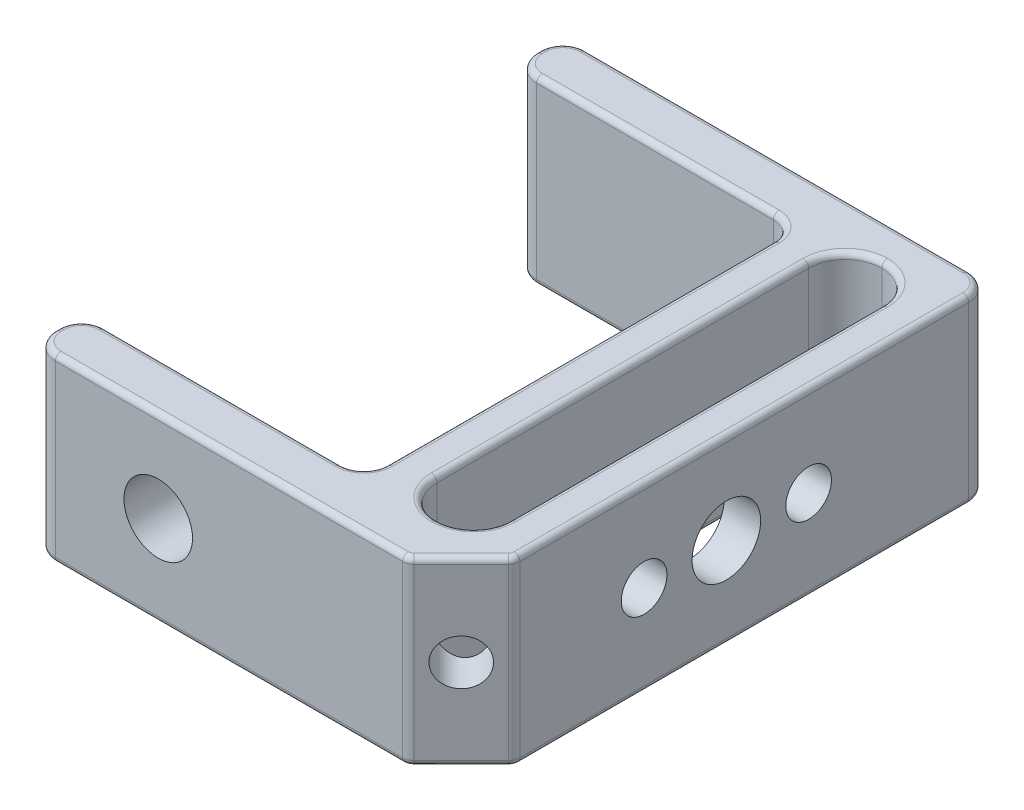
from build123d import *

# Parameters (mm, degrees)
SKETCH1_W               = 10.16
SKETCH1_H               = 61.7855
BOSS_EXTRUDE1_DEPTH     = 25.1841
FILLET2_R               = 5.08
CUT_EXTRUDE1_REACH      = 100.019
SKETCH2_R               = 4.7625
CUT_EXTRUDE2_REACH      = 94.403
CUT_EXTRUDE2_END_RADIUS = 5.08
SKETCH3_R               = 3.175
CUT_EXTRUDE3_REACH      = 100.019
CUT_EXTRUDE4_REACH      = 100.019
CUT_EXTRUDE4_END_RADIUS = 5.08
SKETCH6_R               = 3.175
FILLET3_R               = 3.175
FILLET4_R               = 1.5875
FILLET5_R               = 0.79375


with BuildPart() as part:
    # Sketch1 → Boss-Extrude1 (new body)
    with BuildSketch(Plane(origin=(0, 0, 0), x_dir=(1, 0, 0), z_dir=(0, 1, 0))):
        Polygon((0, 0), (0, -6.7945), (39.243, -6.7945), (39.243, -66.8655), (0, -66.8655), (0, -73.66), (52.07, -73.66), (59.563, -66.167), (59.563, 0), align=None)
        with Locations((49.403, -35.97275)):
            Rectangle(SKETCH1_W, SKETCH1_H, mode=Mode.SUBTRACT)
    extrude(amount=BOSS_EXTRUDE1_DEPTH)

    # Fillet2
    fillet2_edges = [part.edges().sort_by_distance(p)[0] for p in [
        (44.323, 12.59205, 5.08),
        (54.483, 12.59205, 5.08),
        (44.323, 12.59205, 66.8655),
        (54.483, 12.59205, 66.8655),
    ]]
    fillet(fillet2_edges, radius=FILLET2_R - 0.0001)  # a hair under: the kernel refuses the full size

    # Sketch2 → Cut-Extrude1 (cut, up to next)
    with BuildSketch(Plane.XY.offset(73.66), mode=Mode.PRIVATE) as cut_extrude1_sk1:
        with Locations((17.4625, 12.59205)):
            Circle(SKETCH2_R)
    cut_extrude1_tool1 = extrude(cut_extrude1_sk1.sketch, amount=-CUT_EXTRUDE1_REACH, mode=Mode.PRIVATE) & part.part
    add(cut_extrude1_tool1.solids().sort_by_distance((17.4625, 12.59205, 73.66))[0], mode=Mode.SUBTRACT)

    # Cut-Extrude2: up to this cylinder (the profile starts outside it)
    cut_extrude2_end = Plane(origin=(49.403, 12.59205, 61.7855), z_dir=(0, 1, 0)) * Cylinder(CUT_EXTRUDE2_END_RADIUS, 199.966, mode=Mode.PRIVATE)
    # Sketch3 → Cut-Extrude2 (cut, up to the surface)
    with BuildSketch(Plane(origin=(62.865, 0, 62.865), x_dir=(0.707106781186546, 0, -0.707106781186549), z_dir=(0.707106781186549, 0, 0.707106781186546)), mode=Mode.PRIVATE) as cut_extrude2_sk1:
        with Locations((-9.968084294, 12.59205)):
            Circle(SKETCH3_R)
    cut_extrude2_tool1 = extrude(cut_extrude2_sk1.sketch, amount=-CUT_EXTRUDE2_REACH, mode=Mode.PRIVATE) - cut_extrude2_end
    add(cut_extrude2_tool1.solids().sort_by_distance((55.8165, 12.59205, 69.9135))[0], mode=Mode.SUBTRACT)

    # Sketch4 → Cut-Extrude3 (cut, up to next)
    with BuildSketch(Plane(origin=(59.563, 0, 0), x_dir=(0, 0, -1), z_dir=(1, 0, 0)), mode=Mode.PRIVATE) as cut_extrude3_sk1:
        with BuildLine():
            ThreePointArc((-41.5925, 12.59205), (-36.83, 7.82955), (-32.0675, 12.59205))
            Line((-32.0675, 12.59205), (-41.5925, 12.59205))
        make_face()
    cut_extrude3_tool1 = extrude(cut_extrude3_sk1.sketch, amount=-CUT_EXTRUDE3_REACH, mode=Mode.PRIVATE) & part.part
    # Sketch4 → Cut-Extrude3 (cut, up to next)
    with BuildSketch(Plane(origin=(59.563, 0, 0), x_dir=(0, 0, -1), z_dir=(1, 0, 0)), mode=Mode.PRIVATE) as cut_extrude3_sk2:
        with BuildLine():
            Line((-41.5925, 12.59205), (-32.0675, 12.59205))
            ThreePointArc((-32.0675, 12.59205), (-36.83, 17.35455), (-41.5925, 12.59205))
        make_face()
    cut_extrude3_tool2 = extrude(cut_extrude3_sk2.sketch, amount=-CUT_EXTRUDE3_REACH, mode=Mode.PRIVATE) & part.part
    # Sketch4 → Cut-Extrude3 (cut, up to next)
    with BuildSketch(Plane(origin=(59.563, 0, 0), x_dir=(0, 0, -1), z_dir=(1, 0, 0)), mode=Mode.PRIVATE) as cut_extrude3_sk3:
        with BuildLine():
            ThreePointArc((-41.5925, 12.59205), (-36.83, 7.82955), (-32.0675, 12.59205))
            Line((-32.0675, 12.59205), (-41.5925, 12.59205))
        make_face()
    cut_extrude3_tool3 = extrude(cut_extrude3_sk3.sketch, amount=-CUT_EXTRUDE3_REACH, mode=Mode.PRIVATE) & part.part
    # Sketch4 → Cut-Extrude3 (cut, up to next)
    with BuildSketch(Plane(origin=(59.563, 0, 0), x_dir=(0, 0, -1), z_dir=(1, 0, 0)), mode=Mode.PRIVATE) as cut_extrude3_sk4:
        with BuildLine():
            Line((-41.5925, 12.59205), (-32.0675, 12.59205))
            ThreePointArc((-32.0675, 12.59205), (-36.83, 17.35455), (-41.5925, 12.59205))
        make_face()
    cut_extrude3_tool4 = extrude(cut_extrude3_sk4.sketch, amount=-CUT_EXTRUDE3_REACH, mode=Mode.PRIVATE) & part.part
    # Sketch4 → Cut-Extrude3 (cut, up to next)
    with BuildSketch(Plane(origin=(59.563, 0, 0), x_dir=(0, 0, -1), z_dir=(1, 0, 0)), mode=Mode.PRIVATE) as cut_extrude3_sk5:
        with BuildLine():
            ThreePointArc((-28.575, 12.59205), (-25.4, 9.41705), (-22.225, 12.59205))
            Line((-22.225, 12.59205), (-28.575, 12.59205))
        make_face()
    cut_extrude3_tool5 = extrude(cut_extrude3_sk5.sketch, amount=-CUT_EXTRUDE3_REACH, mode=Mode.PRIVATE) & part.part
    # Sketch4 → Cut-Extrude3 (cut, up to next)
    with BuildSketch(Plane(origin=(59.563, 0, 0), x_dir=(0, 0, -1), z_dir=(1, 0, 0)), mode=Mode.PRIVATE) as cut_extrude3_sk6:
        with BuildLine():
            Line((-28.575, 12.59205), (-22.225, 12.59205))
            ThreePointArc((-22.225, 12.59205), (-25.4, 15.76705), (-28.575, 12.59205))
        make_face()
    cut_extrude3_tool6 = extrude(cut_extrude3_sk6.sketch, amount=-CUT_EXTRUDE3_REACH, mode=Mode.PRIVATE) & part.part
    # Sketch4 → Cut-Extrude3 (cut, up to next)
    with BuildSketch(Plane(origin=(59.563, 0, 0), x_dir=(0, 0, -1), z_dir=(1, 0, 0)), mode=Mode.PRIVATE) as cut_extrude3_sk7:
        with BuildLine():
            ThreePointArc((-28.575, 12.59205), (-25.4, 9.41705), (-22.225, 12.59205))
            Line((-22.225, 12.59205), (-28.575, 12.59205))
        make_face()
    cut_extrude3_tool7 = extrude(cut_extrude3_sk7.sketch, amount=-CUT_EXTRUDE3_REACH, mode=Mode.PRIVATE) & part.part
    # Sketch4 → Cut-Extrude3 (cut, up to next)
    with BuildSketch(Plane(origin=(59.563, 0, 0), x_dir=(0, 0, -1), z_dir=(1, 0, 0)), mode=Mode.PRIVATE) as cut_extrude3_sk8:
        with BuildLine():
            Line((-28.575, 12.59205), (-22.225, 12.59205))
            ThreePointArc((-22.225, 12.59205), (-25.4, 15.76705), (-28.575, 12.59205))
        make_face()
    cut_extrude3_tool8 = extrude(cut_extrude3_sk8.sketch, amount=-CUT_EXTRUDE3_REACH, mode=Mode.PRIVATE) & part.part
    # Sketch4 → Cut-Extrude3 (cut, up to next)
    with BuildSketch(Plane(origin=(59.563, 0, 0), x_dir=(0, 0, -1), z_dir=(1, 0, 0)), mode=Mode.PRIVATE) as cut_extrude3_sk9:
        with BuildLine():
            ThreePointArc((-51.435, 12.59205), (-48.26, 9.41705), (-45.085, 12.59205))
            Line((-45.085, 12.59205), (-51.435, 12.59205))
        make_face()
    cut_extrude3_tool9 = extrude(cut_extrude3_sk9.sketch, amount=-CUT_EXTRUDE3_REACH, mode=Mode.PRIVATE) & part.part
    # Sketch4 → Cut-Extrude3 (cut, up to next)
    with BuildSketch(Plane(origin=(59.563, 0, 0), x_dir=(0, 0, -1), z_dir=(1, 0, 0)), mode=Mode.PRIVATE) as cut_extrude3_sk10:
        with BuildLine():
            Line((-51.435, 12.59205), (-45.085, 12.59205))
            ThreePointArc((-45.085, 12.59205), (-48.26, 15.76705), (-51.435, 12.59205))
        make_face()
    cut_extrude3_tool10 = extrude(cut_extrude3_sk10.sketch, amount=-CUT_EXTRUDE3_REACH, mode=Mode.PRIVATE) & part.part
    # Sketch4 → Cut-Extrude3 (cut, up to next)
    with BuildSketch(Plane(origin=(59.563, 0, 0), x_dir=(0, 0, -1), z_dir=(1, 0, 0)), mode=Mode.PRIVATE) as cut_extrude3_sk11:
        with BuildLine():
            ThreePointArc((-51.435, 12.59205), (-48.26, 9.41705), (-45.085, 12.59205))
            Line((-45.085, 12.59205), (-51.435, 12.59205))
        make_face()
    cut_extrude3_tool11 = extrude(cut_extrude3_sk11.sketch, amount=-CUT_EXTRUDE3_REACH, mode=Mode.PRIVATE) & part.part
    # Sketch4 → Cut-Extrude3 (cut, up to next)
    with BuildSketch(Plane(origin=(59.563, 0, 0), x_dir=(0, 0, -1), z_dir=(1, 0, 0)), mode=Mode.PRIVATE) as cut_extrude3_sk12:
        with BuildLine():
            Line((-51.435, 12.59205), (-45.085, 12.59205))
            ThreePointArc((-45.085, 12.59205), (-48.26, 15.76705), (-51.435, 12.59205))
        make_face()
    cut_extrude3_tool12 = extrude(cut_extrude3_sk12.sketch, amount=-CUT_EXTRUDE3_REACH, mode=Mode.PRIVATE) & part.part
    add(cut_extrude3_tool1.solids().sort_by_distance((59.563, 10.570782, 36.83))[0], mode=Mode.SUBTRACT)
    add(cut_extrude3_tool2.solids().sort_by_distance((59.563, 14.613318, 36.83))[0], mode=Mode.SUBTRACT)
    add(cut_extrude3_tool3.solids().sort_by_distance((59.563, 10.570782, 36.83))[0], mode=Mode.SUBTRACT)
    add(cut_extrude3_tool4.solids().sort_by_distance((59.563, 14.613318, 36.83))[0], mode=Mode.SUBTRACT)
    add(cut_extrude3_tool5.solids().sort_by_distance((59.563, 11.244538, 25.4))[0], mode=Mode.SUBTRACT)
    add(cut_extrude3_tool6.solids().sort_by_distance((59.563, 13.939562, 25.4))[0], mode=Mode.SUBTRACT)
    add(cut_extrude3_tool7.solids().sort_by_distance((59.563, 11.244538, 25.4))[0], mode=Mode.SUBTRACT)
    add(cut_extrude3_tool8.solids().sort_by_distance((59.563, 13.939562, 25.4))[0], mode=Mode.SUBTRACT)
    add(cut_extrude3_tool9.solids().sort_by_distance((59.563, 11.244538, 48.26))[0], mode=Mode.SUBTRACT)
    add(cut_extrude3_tool10.solids().sort_by_distance((59.563, 13.939562, 48.26))[0], mode=Mode.SUBTRACT)
    add(cut_extrude3_tool11.solids().sort_by_distance((59.563, 11.244538, 48.26))[0], mode=Mode.SUBTRACT)
    add(cut_extrude3_tool12.solids().sort_by_distance((59.563, 13.939562, 48.26))[0], mode=Mode.SUBTRACT)

    # Cut-Extrude4: up to this cylinder (the profile starts outside it)
    cut_extrude4_end = Plane(origin=(49.403, 12.59205, 10.16), z_dir=(0, 1, 0)) * Cylinder(CUT_EXTRUDE4_END_RADIUS, 211.198, mode=Mode.PRIVATE)
    # Sketch6 → Cut-Extrude4 (cut, up to the surface)
    with BuildSketch(Plane(origin=(0, 0, 0), x_dir=(-1, 0, 0), z_dir=(0, 0, -1)), mode=Mode.PRIVATE) as cut_extrude4_sk1:
        with Locations((-49.53, 12.59205)):
            Circle(SKETCH6_R)
    cut_extrude4_tool1 = extrude(cut_extrude4_sk1.sketch, amount=-CUT_EXTRUDE4_REACH, mode=Mode.PRIVATE) - cut_extrude4_end
    add(cut_extrude4_tool1.solids().sort_by_distance((49.53, 12.59205, 0))[0], mode=Mode.SUBTRACT)

    # Fillet3
    fillet3_edges = [part.edges().sort_by_distance(p)[0] for p in [
        (59.563, 12.59205, 0),
        (0, 12.59205, 73.66),
        (0, 12.59205, 66.8655),
        (39.243, 12.59205, 66.8655),
        (39.243, 12.59205, 6.7945),
        (0, 12.59205, 6.7945),
        (0, 12.59205, 0),
    ]]
    fillet(fillet3_edges, radius=FILLET3_R)

    # Fillet4
    fillet4_edges = [part.edges().sort_by_distance(p)[0] for p in [
        (59.563, 12.59205, 66.167),
        (52.07, 12.59205, 73.66),
    ]]
    fillet(fillet4_edges, radius=FILLET4_R)

    # Fillet5
    fillet5_edges = [part.edges().sort_by_distance(p)[0] for p in [
        (0, 25.1841, 3.39725),
        (19.6215, 25.1841, 6.7945),
        (39.243, 25.1841, 36.83),
        (19.6215, 25.1841, 66.8655),
        (0, 25.1841, 70.26275),
        (27.293717985, 25.1841, 73.66),
        (0.92993597, 25.1841, 0.92993597),
        (0.92993597, 25.1841, 5.86456403),
        (0.92993597, 25.1841, 67.79543597),
        (0.92993597, 25.1841, 72.73006403),
        (58.63306403, 25.1841, 0.92993597),
        (38.31306403, 0, 65.93556403),
        (38.31306403, 25.1841, 65.93556403),
        (38.31306403, 0, 7.72443597),
        (38.31306403, 25.1841, 7.72443597),
        (55.8165, 0, 69.9135),
        (55.8165, 25.1841, 69.9135),
        (59.563, 0, 34.342217985),
        (59.442158758, 0, 66.116945919),
        (52.019945919, 0, 73.539158758),
        (59.563, 25.1841, 34.342217985),
        (59.442158758, 25.1841, 66.116945919),
        (52.019945919, 25.1841, 73.539158758),
        (44.323, 0, 35.97275),
        (44.323, 25.1841, 35.97275),
        (54.483, 0, 35.97275),
        (54.483, 25.1841, 35.97275),
        (45.810868262, 0, 6.567868262),
        (45.810868262, 25.1841, 6.567868262),
        (52.995131738, 0, 6.567868262),
        (52.995131738, 25.1841, 6.567868262),
        (45.810868262, 0, 65.377631738),
        (45.810868262, 25.1841, 65.377631738),
        (52.995131738, 0, 65.377631738),
        (52.995131738, 25.1841, 65.377631738),
        (29.7815, 0, 0),
        (29.7815, 25.1841, 0),
        (27.293717985, 0, 73.66),
        (0, 0, 70.26275),
        (19.6215, 0, 66.8655),
        (39.243, 0, 36.83),
        (19.6215, 0, 6.7945),
        (0, 0, 3.39725),
        (0.92993597, 0, 0.92993597),
        (0.92993597, 0, 5.86456403),
        (0.92993597, 0, 67.79543597),
        (0.92993597, 0, 72.73006403),
        (58.63306403, 0, 0.92993597),
    ]]
    fillet(fillet5_edges, radius=FILLET5_R)


solid = part.part
